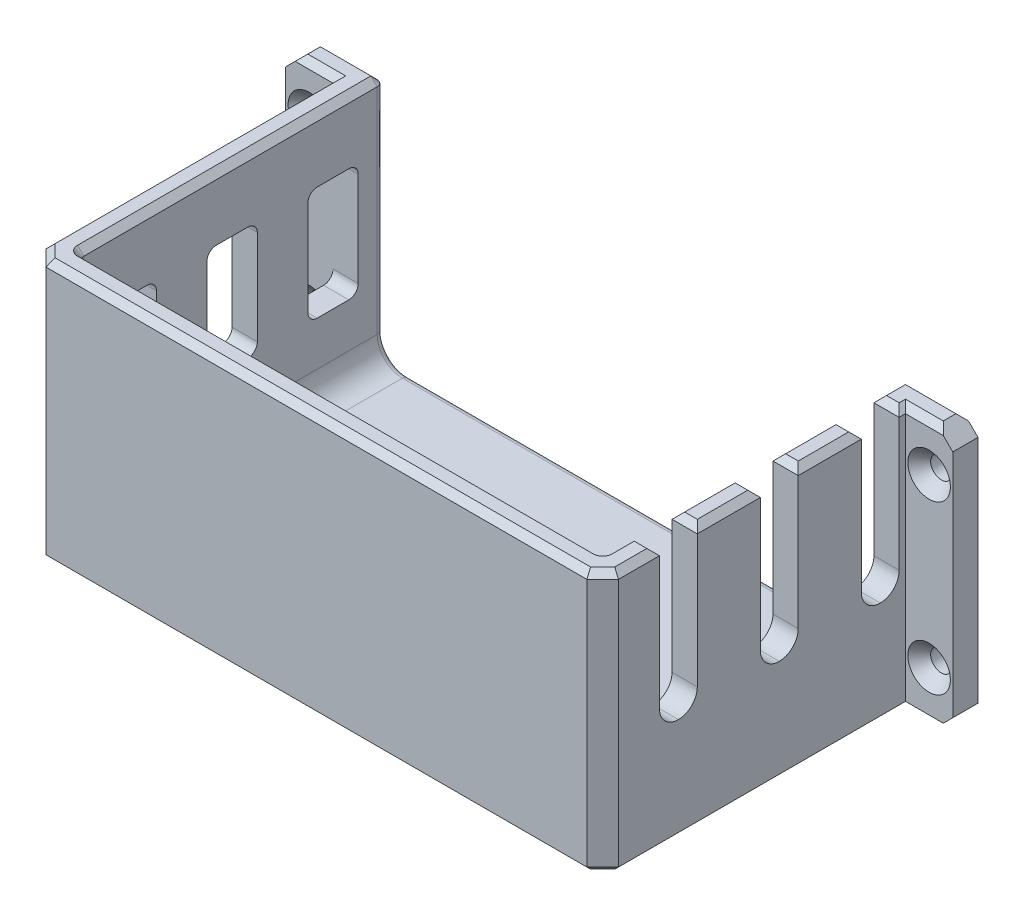
from build123d import *

# Parameters (mm, degrees)
BOSS_EXTRUDE1_DEPTH                                 = 78
BOSS_EXTRUDE2_DEPTH                                 = 5
CUT_EXTRUDE1_START                                  = -20
SKETCH4_W                                           = 8
SKETCH4_H                                           = 16
CUT_EXTRUDE1_DEPTH                                  = 36
SKETCH4_5_W                                         = 8
SKETCH4_5_H                                         = 12
CUT_EXTRUDE2_DEPTH                                  = 50
CSK_FOR_1_4_FLAT_HEAD_SOCKET_CAP_SCREW1_D           = 6.7564
CSK_FOR_1_4_FLAT_HEAD_SOCKET_CAP_SCREW1_CSINK_D     = 13.4874
CSK_FOR_1_4_FLAT_HEAD_SOCKET_CAP_SCREW1_CSINK_ANGLE = 82
FILLET1_R                                           = 3
FILLET2_R                                           = 6
FILLET4_R                                           = 8
FILLET3_R                                           = 2
FILLET5_R                                           = 1
CHAMFER1_SIZE                                       = 5
CHAMFER2_SIZE                                       = 2


with BuildPart() as part:
    # Sketch1 → Boss-Extrude1 (new body)
    with BuildSketch(Plane(origin=(0, 0, 0), x_dir=(1, 0, 0), z_dir=(0, 1, 0))):
        Polygon((0, 0), (-23, 0), (-23, -8), (-8, -8), (-8, -104), (173.5, -104), (173.5, -8), (188.5, -8), (188.5, 0), (165.5, 0), (165.5, -96), (0, -96), align=None)
    extrude(amount=BOSS_EXTRUDE1_DEPTH)

    # Sketch2 → Boss-Extrude2 (add)
    with BuildSketch(Plane.XZ):
        Polygon((-23, 0), (188.5, 0), (188.5, 8), (173.5, 8), (173.5, 104), (-8, 104), (-8, 8), (-23, 8), align=None)
    extrude(amount=BOSS_EXTRUDE2_DEPTH)

    # Sketch4 → Cut-Extrude1 (cut)
    with BuildSketch(Plane(origin=(0, 78, 0), x_dir=(1, 0, 0), z_dir=(0, 1, 0)).offset(CUT_EXTRUDE1_START)):
        with Locations((-4, -16)):
            Rectangle(SKETCH4_W, SKETCH4_H)
        with Locations((-4, -48)):
            Rectangle(SKETCH4_W, SKETCH4_H)
        with Locations((-4, -80)):
            Rectangle(SKETCH4_W, SKETCH4_H)
    extrude(amount=-CUT_EXTRUDE1_DEPTH, mode=Mode.SUBTRACT)

    # Sketch4<5> → Cut-Extrude2 (cut)
    with BuildSketch(Plane(origin=(0, 78, 0), x_dir=(1, 0, 0), z_dir=(0, 1, 0))):
        with Locations((169.5, -48)):
            Rectangle(SKETCH4_5_W, SKETCH4_5_H)
        with Locations((169.5, -80)):
            Rectangle(SKETCH4_5_W, SKETCH4_5_H)
        with Locations((169.5, -16)):
            Rectangle(SKETCH4_5_W, SKETCH4_5_H)
    extrude(amount=-CUT_EXTRUDE2_DEPTH, mode=Mode.SUBTRACT)

    # CSK for 1/4 Flat Head Socket Cap Screw1 (through all)
    with Locations(Plane.XY.offset(8)):
        with Locations((181, 10), (181, 63)):
            csk_for_1_4_flat_head_socket_cap_screw1 = CounterSinkHole(CSK_FOR_1_4_FLAT_HEAD_SOCKET_CAP_SCREW1_D / 2, CSK_FOR_1_4_FLAT_HEAD_SOCKET_CAP_SCREW1_CSINK_D / 2, counter_sink_angle=CSK_FOR_1_4_FLAT_HEAD_SOCKET_CAP_SCREW1_CSINK_ANGLE)

    # Mirror1: CSK for 1/4 Flat Head Socket Cap Screw1 across plane
    add(csk_for_1_4_flat_head_socket_cap_screw1.mirror(Plane(origin=(82.75, 0, 0), x_dir=(0, 0, 1), z_dir=(1, 0, 0))), mode=Mode.SUBTRACT)

    # Fillet1
    fillet1_edges = [part.edges().sort_by_distance(p)[0] for p in [
        (-4, 22, 24),
        (-4, 22, 8),
        (-4, 58, 8),
        (-4, 58, 24),
        (-4, 58, 56),
        (-4, 58, 40),
        (-4, 22, 56),
        (-4, 22, 40),
        (-4, 58, 88),
        (-4, 58, 72),
        (-4, 22, 88),
        (-4, 22, 72),
    ]]
    fillet(fillet1_edges, radius=FILLET1_R)

    # Fillet2
    fillet2_edges = [part.edges().sort_by_distance(p)[0] for p in [
        (169.5, 28, 74),
        (169.5, 28, 42),
        (169.5, 28, 86),
        (169.5, 28, 54),
        (169.5, 28, 22),
        (169.5, 28, 10),
    ]]
    fillet(fillet2_edges, radius=FILLET2_R - 0.0001)  # a hair under: the kernel refuses the full size

    # Fillet4
    fillet4_edges = [part.edges().sort_by_distance(p)[0] for p in [
        (165.5, 0, 48),
        (0, 0, 48),
    ]]
    fillet(fillet4_edges, radius=FILLET4_R)

    # Fillet3
    fillet3_edges = [part.edges().sort_by_distance(p)[0] for p in [
        (165.5, 43, 0),
        (0, 43, 0),
        (82.75, 0, 0),
        (2.343145751, 2.343145751, 0),
        (163.156854249, 2.343145751, 0),
    ]]
    fillet(fillet3_edges, radius=FILLET3_R)

    # Fillet5
    fillet5_edges = [part.edges().sort_by_distance(p)[0] for p in [
        (0, 43, 96),
        (165.5, 43, 96),
        (82.75, 0, 96),
        (163.156854249, 2.343145751, 96),
        (2.343145751, 2.343145751, 96),
    ]]
    fillet(fillet5_edges, radius=FILLET5_R)

    # Chamfer1
    chamfer1_edges = [part.edges().sort_by_distance(p)[0] for p in [
        (-23, 78, 4),
        (173.5, 36.5, 104),
        (-8, 36.5, 104),
        (188.5, 78, 4),
        (-23, -5, 4),
        (188.5, -5, 4),
    ]]
    chamfer(chamfer1_edges, length=CHAMFER1_SIZE)

    # Chamfer2
    chamfer2_edges = [part.edges().sort_by_distance(p)[0] for p in [
        (82.75, -5, 0),
        (178.5, -5, 8),
        (173.5, -5, 53.5),
        (171, -5, 101.5),
        (82.75, -5, 104),
        (-5.5, -5, 101.5),
        (-13, -5, 8),
        (-8, -5, 53.5),
        (173.5, 78, 9),
        (178.5, 78, 8),
        (173.5, 78, 32),
        (165.5, 78, 32),
        (165.5, 78, 64),
        (173.5, 78, 64),
        (165.5, 78, 6),
        (175.5, 78, 0),
        (173.5, 78, 92.5),
        (171, 78, 101.5),
        (82.75, 78, 104),
        (-5.5, 78, 101.5),
        (-8, 78, 53.5),
        (-13, 78, 8),
        (165.5, 78, 90.5),
        (82.75, 78, 96),
        (-10, 78, 0),
        (0, 78, 48.5),
        (169.5, 78, 22),
        (169.5, 78, 42),
        (169.5, 78, 54),
        (169.5, 78, 74),
        (169.5, 78, 10),
        (169.5, 78, 86),
        (166.085786438, 78, 0.585786438),
        (-0.585786438, 78, 0.585786438),
        (165.207106781, 78, 95.707106781),
        (0.292893219, 78, 95.707106781),
    ]]
    chamfer(chamfer2_edges, length=CHAMFER2_SIZE - 0.0001)  # a hair under: the kernel refuses the full size


solid = part.part
